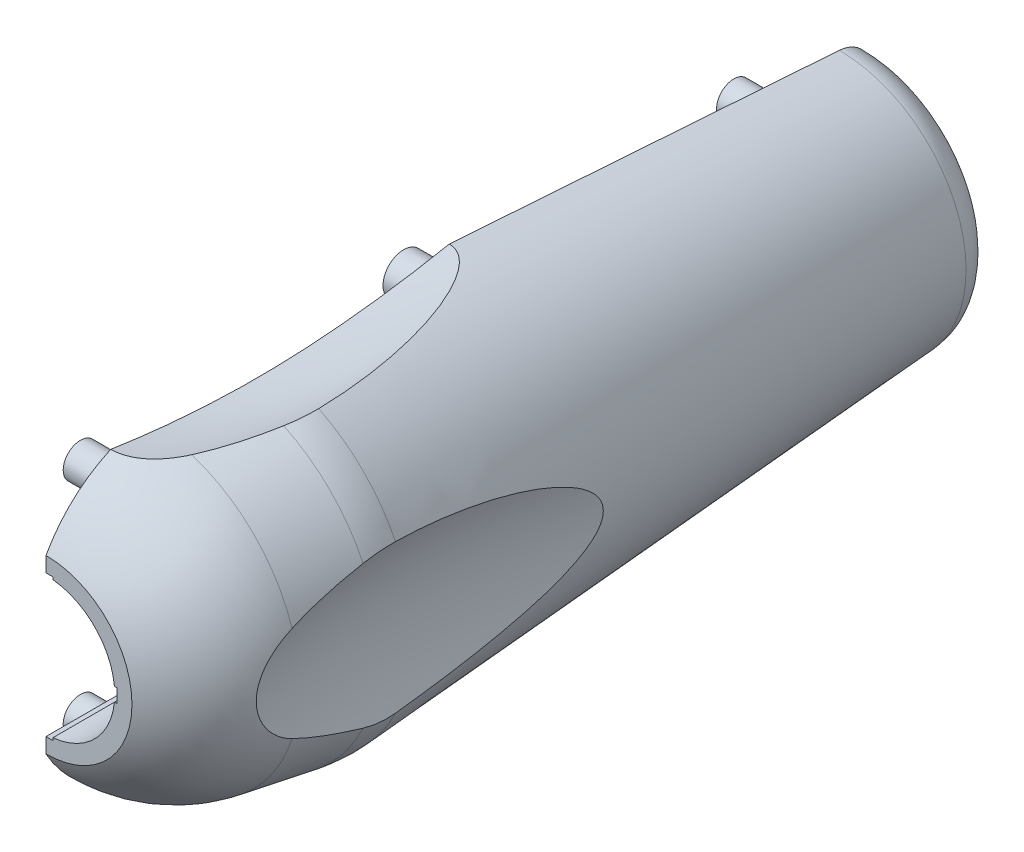
from build123d import *

# Parameters (mm, degrees)
SKETCH1_R               = 11.25
SKETCH1_R_2             = 5
BOSS_EXTRUDE1_DEPTH     = 51
BOSS_EXTRUDE2_START     = 9
SKETCH2_R               = 11.25
BOSS_EXTRUDE2_DEPTH     = 9
CUT_EXTRUDE1_DEPTH      = 6
CUT_EXTRUDE2_START      = -2.5
SKETCH4_W               = 10
SKETCH4_H               = 2.5
CUT_EXTRUDE2_DEPTH      = 5
SKETCH5_R               = 2.5
CUT_EXTRUDE3_DEPTH      = 7.5
SKETCH6_W               = 1
SKETCH6_H               = 0.25
SKETCH6_W_2             = 0.25
SKETCH6_H_2             = 1
CUT_EXTRUDE4_DEPTH      = 10
SKETCH7_W               = 22.5
SKETCH7_H               = 22.5
SKETCH7_R               = 7.5
BOSS_EXTRUDE3_DEPTH     = 55
SKETCH11_R              = 6.25
SKETCH11_R_2            = 5.5
BOSS_EXTRUDE4_DEPTH     = 5
THREAD1_PITCH           = 0.6
SKETCH14_W              = 14.477531198
SKETCH14_H              = 32.54061919
CUT_EXTRUDE5_DEPTH      = 30
CIRPATTERN1_COUNT       = 4
FILLET1_R               = 10
FILLET2_R               = 10
FILLET5_R               = 2.5
SKETCH19_W              = 17.18051928
SKETCH19_H              = 29.497400052
CUT_EXTRUDE6_DEPTH      = 60
CUT_EXTRUDE7_DEPTH      = 10
CUT_EXTRUDE7_DEPTH_BACK = 10
SKETCH20_W              = 12.488269817
SKETCH20_H              = 35.66169028
SKETCH21_R              = 1.25
SKETCH21_R_2            = 1.5
BOSS_EXTRUDE5_DEPTH     = 3


with BuildPart() as part:
    # Sketch1 → Boss-Extrude1 (new body)
    with BuildSketch(Plane.XY):
        Circle(SKETCH1_R)
        Circle(SKETCH1_R_2, mode=Mode.SUBTRACT)
    extrude(amount=BOSS_EXTRUDE1_DEPTH)

    # Sketch2 → Boss-Extrude2 (add)
    with BuildSketch(Plane(origin=(0, 0, 0), x_dir=(-1, 0, 0), z_dir=(0, 0, -1)).offset(BOSS_EXTRUDE2_START)):
        Circle(SKETCH2_R)
    extrude(amount=-BOSS_EXTRUDE2_DEPTH)

    # Sketch3 → Cut-Extrude1 (cut)
    with BuildSketch(Plane(origin=(0, 0, -9), x_dir=(-1, 0, 0), z_dir=(0, 0, -1))):
        Polygon((-2, 4.5), (-3, 3.5), (-3, 2.5), (3, 2.5), (3, 3.5), (2, 4.5), align=None)
    extrude(amount=-CUT_EXTRUDE1_DEPTH, mode=Mode.SUBTRACT)

    # Sketch4 → Cut-Extrude2 (cut)
    with BuildSketch(Plane(origin=(0, 0, -9), x_dir=(-1, 0, 0), z_dir=(0, 0, -1)).offset(CUT_EXTRUDE2_START)):
        with Locations((0, -2.25)):
            Rectangle(SKETCH4_W, SKETCH4_H)
    extrude(amount=-CUT_EXTRUDE2_DEPTH, mode=Mode.SUBTRACT)

    # Sketch5 → Cut-Extrude3 (cut)
    with BuildSketch(Plane(origin=(0, 0, -9), x_dir=(-1, 0, 0), z_dir=(0, 0, -1))):
        with Locations((0, -3.5)):
            Circle(SKETCH5_R)
    extrude(amount=-CUT_EXTRUDE3_DEPTH, mode=Mode.SUBTRACT)

    # Sketch6 → Cut-Extrude4 (cut)
    with BuildSketch(Plane.XY.offset(51)):
        with Locations((0, 5.025)):
            Rectangle(SKETCH6_W, SKETCH6_H)
        with Locations((-5.025, 0)):
            Rectangle(SKETCH6_W_2, SKETCH6_H_2)
        with Locations((5.025, 0)):
            Rectangle(SKETCH6_W_2, SKETCH6_H_2)
        with Locations((0, -5.025)):
            Rectangle(SKETCH6_W, SKETCH6_H)
    extrude(amount=-CUT_EXTRUDE4_DEPTH, mode=Mode.SUBTRACT)

    # Sketch7 → Boss-Extrude3 (add)
    with BuildSketch(Plane.XY.offset(51)):
        Rectangle(SKETCH7_W, SKETCH7_H)
        Circle(SKETCH7_R, mode=Mode.SUBTRACT)
    extrude(amount=-BOSS_EXTRUDE3_DEPTH)

    # Sketch11 → Boss-Extrude4 (add)
    with BuildSketch(Plane.XY.offset(51)):
        Circle(SKETCH11_R)
        Circle(SKETCH11_R_2, mode=Mode.SUBTRACT)
    extrude(amount=BOSS_EXTRUDE4_DEPTH)

    # Thread1: the profile of Thread Profile1 profile screwed along a right-hand helix of 10 turns, 6 arcs to a turn; built about Z, then put on its axis
    thread1_z = Axis((0, 0, 0), (0, 0, 1))
    thread1_corners = [(5.5003, 0, -0.000173205), (5.5003, 0, 0.525173203), (5.175240475, 0, 0.337499999), (5.175240475, 0, 0.187499999)]
    with BuildLine(mode=Mode.PRIVATE) as thread1_profile:
        Line(thread1_corners[0], thread1_corners[1])
        Line(thread1_corners[1], thread1_corners[2])
        Line(thread1_corners[2], thread1_corners[3])
        Line(thread1_corners[3], thread1_corners[0])
    thread1_cap = Face(thread1_profile.wire())
    thread1_turn_angles = [0, 30, 60, 90, 120, 150, 180, 210, 240, 270, 300, 330, 360]
    thread1_turn_weights = [1, 0.8660254037844387, 1, 0.8660254037844387, 1, 0.8660254037844387, 1, 0.8660254037844387, 1, 0.8660254037844387, 1, 0.8660254037844387, 1]
    thread1_turn_rails = [Edge.make_bspline([Vector(p[0], p[1], 0).rotate(thread1_z, thread1_turn_angles[k]) / thread1_turn_weights[k] + Vector(0, 0, p[2] + THREAD1_PITCH * thread1_turn_angles[k] / 360) for k in range(13)], [0, 0, 0, 1, 1, 2, 2, 3, 3, 4, 4, 5, 5, 6, 6, 6], 2, thread1_turn_weights) for p in thread1_corners]
    thread1_turn_sides = [Face.make_surface_from_curves(thread1_turn_rails[p[0]], thread1_turn_rails[p[1]]) for p in [(0, 1), (1, 2), (2, 3), (3, 0)]]
    thread1 = Plane(origin=(0, 0, 57), x_dir=(-1, 0, 0), z_dir=(0, 0, -1)) * Solid(Shell([*[p.moved(Location((0, 0, THREAD1_PITCH * i))) for i in range(10) for p in thread1_turn_sides], thread1_cap, thread1_cap.rotate(thread1_z, 3600).moved(Location((0, 0, THREAD1_PITCH * 3600 / 360)))]))
    add(thread1)

    # Sketch14 → Cut-Extrude5 (cut)
    with BuildSketch(Plane(origin=(11.25, 0, 0), x_dir=(0, 0, -1), z_dir=(1, 0, 0))):
        with Locations((-63.170516655, 2.469298546)):
            Rectangle(SKETCH14_W, SKETCH14_H)
    extrude(amount=-CUT_EXTRUDE5_DEPTH, mode=Mode.SUBTRACT)

    # Sketch15 → Cut-Revolve2 (revolve, cut)
    with BuildSketch(Plane(origin=(0, 0, 0), x_dir=(1, 0, 0), z_dir=(0, 1, 0)), mode=Mode.PRIVATE) as cut_revolve2_sk:
        Polygon((-9, 9.75), (-12.321523567, -37.75), (-9, -57.75), (-13.720059806, -57.75), (-54, -633.779981552), (-54, 9.75), align=None)
    revolve(cut_revolve2_sk.sketch.rotate(Axis((0, 0, 0), (0, 0, -1)), 354.260829523), axis=Axis((0, 0, 0), (0, 0, -1)), mode=Mode.SUBTRACT)

    # Sketch17 → Cut-Revolve3 (revolve, cut)
    with BuildSketch(Plane(origin=(0, 22.25, 0), x_dir=(1, 0, 0), z_dir=(0, 1, 0))):
        with BuildLine():
            Line((0, 8.75), (0, -80.25))
            add(Edge.make_bspline(
                [(0, 8.75), (-6.837392998, -4.833326361), (-18.162607002, -35.75), (-6.837392998, -66.666673639), (0, -80.25)],
                knots=[0, 0, 0, 0, 0.5, 1, 1, 1, 1], degree=3))
        make_face()
    cut_revolve3 = revolve(axis=Axis((0, 22.25, -8.75), (0, 0, 1)), mode=Mode.SUBTRACT)

    # CirPattern1: Cut-Revolve3 ×4 about axis
    cirpattern1_axis = Axis((0, 0, 56), (0, 0, -1))
    for i in range(1, CIRPATTERN1_COUNT):
        add(cut_revolve3.rotate(cirpattern1_axis, i * 360 / CIRPATTERN1_COUNT), mode=Mode.SUBTRACT)

    # Fillet1
    # the kernel refuses this fillet: 10 mm, written as the material it takes off along each edge
    with BuildSketch(Plane(origin=(0, 0, 51), x_dir=(-0.9949874371070855, -0.0999999999953677, 0), z_dir=(-0.0999999999953677, 0.9949874371070855, 0))) as fillet1_piece_1:
        with BuildLine():
            CenterArc((1.440076791, -8.76724807), FILLET1_R, 9.429400963, 51.820366909)
            Line((11.304959012, -7.128926131), (11.502256656, -7.096159692))
            Line((11.502256656, -7.096159692), (10.318311848, 0.032766439))
            Line((10.318311848, 0.032766439), (10.121014204, 0.2))
            ThreePointArc((10.121014204, 0.2), (8.185507102, 0.2), (6.346198464, 0.175344961))
            Line((6.346198464, 0.175344961), (6.25, 0))
        make_face()
    revolve(axis=Axis((0, 0, 51), (0, 0, 1)), mode=Mode.SUBTRACT)

    # Fillet2
    # the kernel refuses this fillet: 10 mm, written as the material it takes off along each edge
    with BuildSketch(Plane(origin=(0, 0, 37.75), x_dir=(-0.9757453399449544, 0.21890872887051724, 0), z_dir=(-0.21890872887051724, -0.9757453399449544, 0))) as fillet2_piece_1:
        with BuildLine():
            CenterArc((12.321523567 - FILLET2_R * 1.00577669767, FILLET2_R * 0.0476898560037), FILLET2_R, 350.570599037, 13.429400963)
            Line((12.321523567 - FILLET2_R * 0.00821264741373, FILLET2_R * 0.117446329748), (12.321523567, 0))
            Line((12.321523567, 0), (12.321523567 - FILLET2_R * 0.0192884756277, -FILLET2_R * 0.116142337917))
        make_face()
    revolve(axis=Axis((0, 0, 37.75), (0, 0, -1)), revolution_arc=64.710109031, mode=Mode.SUBTRACT)
    with BuildSketch(Plane(origin=(0, 0, 37.75), x_dir=(-0.21890872887051768, -0.975745339944954, 0), z_dir=(0.975745339944954, -0.21890872887051768, 0))) as fillet2_piece_2:
        with BuildLine():
            CenterArc((12.321523567 - FILLET2_R * 1.00577669767, FILLET2_R * 0.0476898560037), FILLET2_R, 350.570599037, 13.429400963)
            Line((12.321523567 - FILLET2_R * 0.00821264741373, FILLET2_R * 0.117446329748), (12.321523567, 0))
            Line((12.321523567, 0), (12.321523567 - FILLET2_R * 0.0192884756277, -FILLET2_R * 0.116142337917))
        make_face()
    revolve(axis=Axis((0, 0, 37.75), (0, 0, -1)), revolution_arc=64.710109031, mode=Mode.SUBTRACT)
    with BuildSketch(Plane(origin=(0, 0, 37.75), x_dir=(0.9757453399449539, -0.21890872887051863, 0), z_dir=(0.21890872887051863, 0.9757453399449539, 0))) as fillet2_piece_3:
        with BuildLine():
            CenterArc((12.321523567 - FILLET2_R * 1.00577669767, FILLET2_R * 0.0476898560037), FILLET2_R, 350.570599037, 13.429400963)
            Line((12.321523567 - FILLET2_R * 0.00821264741373, FILLET2_R * 0.117446329748), (12.321523567, 0))
            Line((12.321523567, 0), (12.321523567 - FILLET2_R * 0.0192884756277, -FILLET2_R * 0.116142337917))
        make_face()
    revolve(axis=Axis((0, 0, 37.75), (0, 0, -1)), revolution_arc=64.710109031, mode=Mode.SUBTRACT)
    with BuildSketch(Plane(origin=(0, 0, 37.75), x_dir=(0.21890872887051785, 0.9757453399449543, 0), z_dir=(-0.9757453399449543, 0.21890872887051785, 0))) as fillet2_piece_4:
        with BuildLine():
            CenterArc((12.321523567 - FILLET2_R * 1.00577669767, FILLET2_R * 0.0476898560037), FILLET2_R, 350.570599037, 13.429400963)
            Line((12.321523567 - FILLET2_R * 0.00821264741373, FILLET2_R * 0.117446329748), (12.321523567, 0))
            Line((12.321523567, 0), (12.321523567 - FILLET2_R * 0.0192884756277, -FILLET2_R * 0.116142337917))
        make_face()
    revolve(axis=Axis((0, 0, 37.75), (0, 0, -1)), revolution_arc=64.710109031, mode=Mode.SUBTRACT)

    # Fillet5
    fillet5_edges = [part.edges().sort_by_distance(p)[0] for p in [
        (9.007069159, 0.905244511, -9),
    ]]
    fillet(fillet5_edges, radius=FILLET5_R)

    # Sketch19 → Cut-Extrude6 (cut)
    with BuildSketch(Plane(origin=(0, 0, -9), x_dir=(-1, 0, 0), z_dir=(0, 0, -1))):
        with Locations((8.59025964, -0.216909103)):
            Rectangle(SKETCH19_W, SKETCH19_H)
    extrude(amount=-CUT_EXTRUDE6_DEPTH, mode=Mode.SUBTRACT)

    # Sketch20 → Cut-Extrude7 (cut, two sides: drawn at the far end of the back side and taken through both)
    with BuildSketch(Plane.ZY.offset(-CUT_EXTRUDE7_DEPTH_BACK)):
        with Locations((57.244134909, -2.227589785)):
            Rectangle(SKETCH20_W, SKETCH20_H)
    extrude(amount=CUT_EXTRUDE7_DEPTH + CUT_EXTRUDE7_DEPTH_BACK, mode=Mode.SUBTRACT)

    # Sketch21 → Boss-Extrude5 (add)
    with BuildSketch(Plane.ZY):
        with Locations(Location((-2, 7, 0), (0, 0, 180))):
            Circle(SKETCH21_R)
        with Locations(Location((22, 8, 0), (0, 0, 180))):
            Circle(SKETCH21_R_2)
        with Locations(Location((45.5, 8, 0), (0, 0, 180))):
            Circle(SKETCH21_R)
        with Locations(Location((45.5, -8, 0), (0, 0, 180))):
            Circle(SKETCH21_R)
        with Locations(Location((22, -8, 0), (0, 0, 180))):
            Circle(SKETCH21_R_2)
    extrude(amount=BOSS_EXTRUDE5_DEPTH)


solid = part.part
